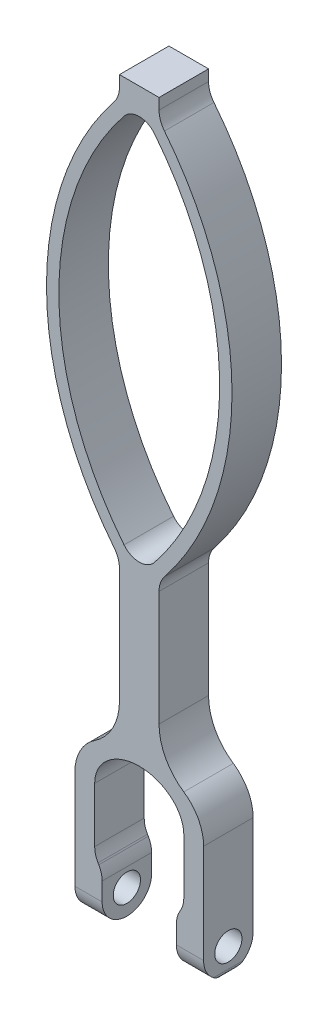
from build123d import *

# Parameters (mm, degrees)
BOSS_EXTRUDE1_DEPTH      = 10
BOSS_EXTRUDE1_DEPTH_BACK = 10
FILLET1_START            = -10
FILLET1_DEPTH            = 20
FILLET1_START_2          = -11
FILLET1_2_DEPTH          = 22
FILLET1_START_3          = -27
FILLET1_3_DEPTH          = 54
CUT_EXTRUDE1_DEPTH       = 296.556321193
CUT_EXTRUDE1_DEPTH_BACK  = 296.556321193
SKETCH2_R                = 5.5


with BuildPart() as part:
    # Sketch1 → Boss-Extrude1 (new, two sides: drawn at the far end of the back side and taken through both)
    with BuildSketch(Plane.XY.offset(-BOSS_EXTRUDE1_DEPTH_BACK)):
        with BuildLine():
            Line((15, -10), (15, 10))
            Line((15, 10), (18, 15.196152423))
            Line((18, 15.196152423), (18, 40))
            add(Edge.make_bspline(
                [(18, 40), (18, 55), (0, 55), (-18, 55), (-18, 40)],
                knots=[3.141592654, 3.141592654, 3.141592654, 4.71238898, 4.71238898, 6.283185307, 6.283185307, 6.283185307], degree=2, weights=[1, 0.707106781, 1, 0.707106781, 1]))
            Line((-18, 40), (-18, 15.196152423))
            Line((-18, 15.196152423), (-15, 10))
            Line((-15, 10), (-15, -10))
            Line((-15, -10), (-24, -10))
            ThreePointArc((-24, -10), (-25.414213562, -9.414213562), (-26, -8))
            Line((-26, -8), (-26, 40))
            ThreePointArc((-26, 40), (-23.875, 48.5), (-18, 55))
            ThreePointArc((-18, 55), (-10.65625, 63.125), (-8, 73.75))
            Line((-8, 73.75), (-8, 120.173252984))
            ThreePointArc((-8, 120.173252984), (-8.561645992, 123.477413032), (-10.183494724, 126.41041943))
            ThreePointArc((-10.183494724, 126.41041943), (-37.477178774, 204.375), (-10.183494724, 282.33958057))
            ThreePointArc((-10.183494724, 282.33958057), (-8.561645992, 285.272586968), (-8, 288.576747016))
            Line((-8, 288.576747016), (-8, 293))
            Line((-8, 293), (8, 293))
            Line((8, 293), (8, 288.576747016))
            ThreePointArc((8, 288.576747016), (8.561645992, 285.272586968), (10.183494724, 282.33958057))
            ThreePointArc((10.183494724, 282.33958057), (37.477178774, 204.375), (10.183494724, 126.41041943))
            ThreePointArc((10.183494724, 126.41041943), (8.561645992, 123.477413032), (8, 120.173252984))
            Line((8, 120.173252984), (8, 73.75))
            ThreePointArc((8, 73.75), (10.65625, 63.125), (18, 55))
            ThreePointArc((18, 55), (23.875, 48.5), (26, 40))
            Line((26, 40), (26, -8))
            ThreePointArc((26, -8), (25.414213562, -9.414213562), (24, -10))
            Line((24, -10), (15, -10))
        make_face()
        with BuildLine():
            ThreePointArc((-6.15214875, 279.375), (-32.477178774, 204.375), (-6.15214875, 129.375))
            ThreePointArc((-6.15214875, 129.375), (0, 126.419603336), (6.15214875, 129.375))
            ThreePointArc((6.15214875, 129.375), (32.477178774, 204.375), (6.15214875, 279.375))
            ThreePointArc((6.15214875, 279.375), (0, 282.330396664), (-6.15214875, 279.375))
        make_face(mode=Mode.SUBTRACT)
    extrude(amount=BOSS_EXTRUDE1_DEPTH + BOSS_EXTRUDE1_DEPTH_BACK)

    # Fillet1: read off the stored shape, not the designer's step
    # Fillet1 outline → Fillet1 (add)
    with BuildSketch(Plane.XY.offset(FILLET1_START)):
        with BuildLine():
            Line((18, 15.196152423), (18, 17.875644347))
            ThreePointArc((18, 17.875644347), (17.659258263, 15.287453896), (16.660254038, 12.875644347))
            Line((16.660254038, 12.875644347), (18, 15.196152423))
        make_face()
        with BuildLine():
            Line((-18, 15.196152423), (-16.660254038, 12.875644347))
            ThreePointArc((-16.660254038, 12.875644347), (-17.659258263, 15.287453896), (-18, 17.875644347))
            Line((-18, 17.875644347), (-18, 15.196152423))
        make_face()
    extrude(amount=FILLET1_DEPTH)

    # Fillet1 2 outline → Fillet1 2 (cut)
    with BuildSketch(Plane.XY.offset(FILLET1_START_2)):
        with BuildLine():
            ThreePointArc((15, 7.320508076), (15.340741737, 9.908698527), (16.339745962, 12.320508076))
            Line((16.339745962, 12.320508076), (15, 10))
            Line((15, 10), (15, 7.320508076))
        make_face()
        with BuildLine():
            ThreePointArc((-16.339745962, 12.320508076), (-15.340741737, 9.908698527), (-15, 7.320508076))
            Line((-15, 7.320508076), (-15, 10))
            Line((-15, 10), (-16.339745962, 12.320508076))
        make_face()
    extrude(amount=FILLET1_2_DEPTH, mode=Mode.SUBTRACT)

    # Fillet1 3 outline → Fillet1 3 (cut)
    with BuildSketch(Plane.YZ.offset(FILLET1_START_3)):
        with BuildLine():
            Line((-10, 10), (-10, 0))
            ThreePointArc((-10, 0), (-7.071067812, 7.071067812), (0, 10))
            Line((0, 10), (-10, 10))
        make_face()
        with BuildLine():
            ThreePointArc((0, -10), (-7.071067812, -7.071067812), (-10, 0))
            Line((-10, 0), (-10, -10))
            Line((-10, -10), (0, -10))
        make_face()
    extrude(amount=FILLET1_3_DEPTH, mode=Mode.SUBTRACT)

    # Sketch2 → Cut-Extrude1 (cut, two sides: drawn at the far end of the back side and taken through both)
    with BuildSketch(Plane(origin=(0, 0, 0), x_dir=(0, 0, -1), z_dir=(1, 0, 0)).offset(-CUT_EXTRUDE1_DEPTH_BACK)):
        with Locations(Location((0, 0, 0), (0, 0, 90))):
            Circle(SKETCH2_R)
    extrude(amount=CUT_EXTRUDE1_DEPTH + CUT_EXTRUDE1_DEPTH_BACK, mode=Mode.SUBTRACT)


solid = part.part
